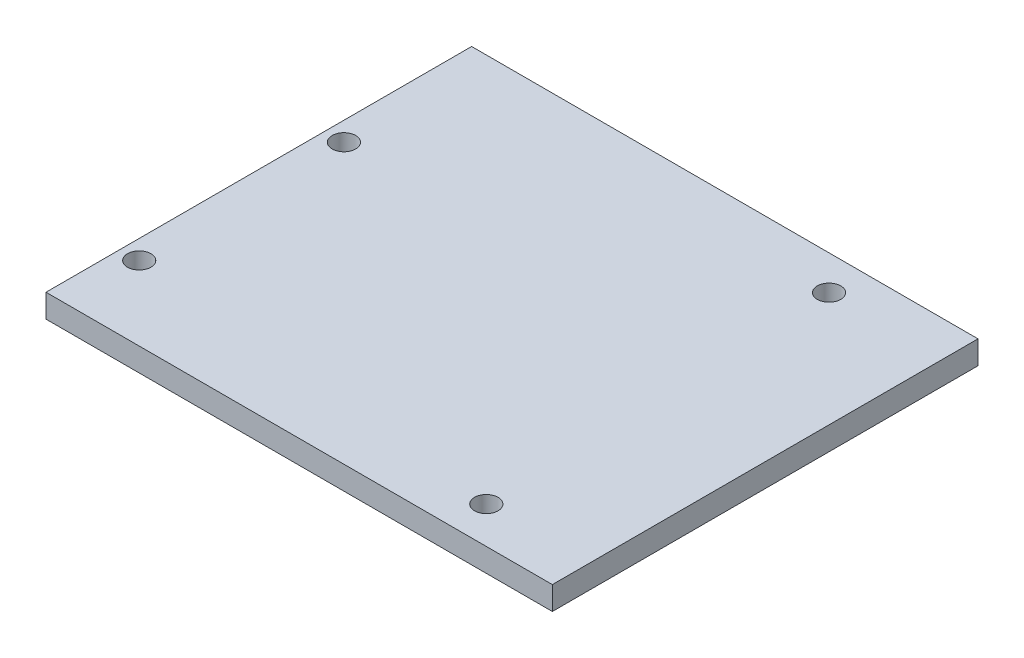
from build123d import *

# Parameters (mm, degrees)
SKETCH1_W           = 69
SKETCH1_H           = 58
BOSS_EXTRUDE1_DEPTH = 3.18
SKETCH2_R           = 1.6
CUT_EXTRUDE1_DEPTH  = 46.181438667


with BuildPart() as part:
    # Sketch1 → Boss-Extrude1 (new body)
    with BuildSketch(Plane(origin=(0, 0, 0), x_dir=(1, 0, 0), z_dir=(0, 1, 0))):
        Rectangle(SKETCH1_W, SKETCH1_H)
    extrude(amount=BOSS_EXTRUDE1_DEPTH)

    # Sketch2 → Cut-Extrude1 (cut, through all)
    with BuildSketch(Plane(origin=(0, 3.18, 0), x_dir=(1, 0, 0), z_dir=(0, 1, 0))):
        with Locations((-31.9, 9)):
            Circle(SKETCH2_R)
        with Locations((-31.9, -18.9)):
            Circle(SKETCH2_R)
        with Locations((18.9, 24.3)):
            Circle(SKETCH2_R)
        with Locations((20.5, -24)):
            Circle(SKETCH2_R)
    extrude(amount=-CUT_EXTRUDE1_DEPTH, mode=Mode.SUBTRACT)


solid = part.part
